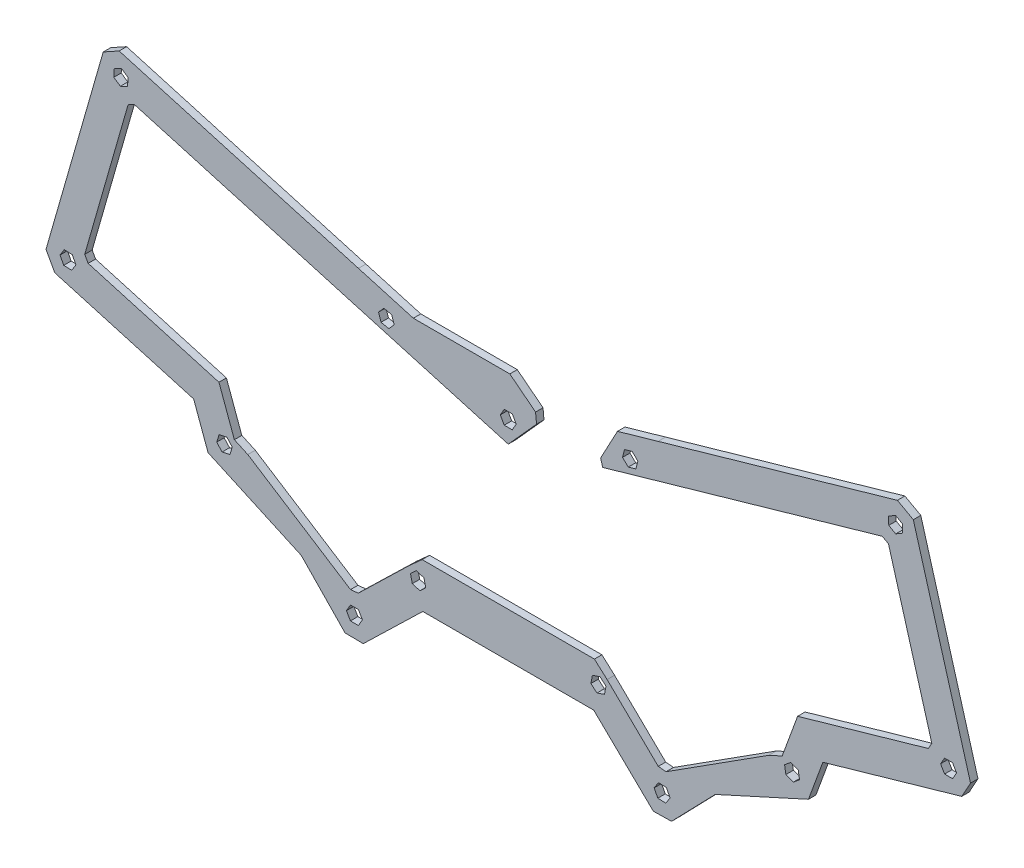
from build123d import *

# Parameters (mm, degrees)
BOSS_EXTRU_1_DEPTH = 3


with BuildPart() as part:
    # Esquisse1 → Boss.-Extru.1 (new body)
    with BuildSketch(Plane.XY):
        Polygon((-202.439042401, -93.715936913), (-207.540430482, -98.290842938), (-228.119574859, -118.248029963), (-231.240854108, -118.563827288), (-272.565847516, -92.169507978), (-277.959789872, -89.716454796), (-284.165989399, -72.783703169), (-336.775785376, -57.698086926), (-338.147034057, -55.224288823), (-320.713145188, 5.574907028), (-318.239316427, 6.946262636), (-167.795259872, -36.183821192), (-156.425730461, -23.544541546), (-156.815310501, -19.508703235), (-167.175777529, -11.401531345), (-205.982988252, -11.401531345), (-221.327812729, -7.001473731), (-228.053301524, -5.072970852), (-324.305573392, 22.521130566), (-330.707501003, 18.97225141), (-353.72243999, -61.290379239), (-350.173829458, -67.692242105), (-294.328030452, -83.705767284), (-288.532091821, -99.519179156), (-251.042661762, -116.568594893), (-233.45174982, -134.735979634), (-226.135810249, -134.851076098), (-202.175390102, -111.650948678), (-133.415129641, -111.650948678), (-109.454709494, -134.851076098), (-102.138769923, -134.735979634), (-84.547857981, -116.568594893), (-47.058427922, -99.519179156), (-41.262489291, -83.705767284), (14.583309715, -67.692242105), (18.131920247, -61.290379239), (-4.88301874, 18.97225141), (-11.284946351, 22.521130566), (-107.537218219, -5.072970852), (-114.262707014, -7.001473731), (-123.876268292, -9.758118068), (-130.649820486, -22.415487094), (-129.8232917, -25.297935522), (-127.904950096, -24.747859919), (-17.351203316, 6.946262636), (-14.877374555, 5.574907028), (2.556514314, -55.224288823), (1.185265633, -57.698086926), (-51.424530344, -72.783703169), (-57.630729871, -89.716454796), (-63.024672228, -92.169507978), (-104.349665635, -118.563827288), (-107.470944884, -118.248029963), (-128.050089261, -98.290842938), (-133.151477342, -93.715936913), align=None)
        Polygon((-226.456549288, -126.726039887), (-228.072581173, -129.499661036), (-231.282623491, -129.486946945), (-232.876633924, -126.700611704), (-231.260602039, -123.926990555), (-228.050559721, -123.939704646), align=None, mode=Mode.SUBTRACT)
        Polygon((-201.720052379, -99.68218544), (-200.986265397, -102.807259839), (-203.325765724, -105.005275206), (-206.399053033, -104.078216174), (-207.132840016, -100.953141775), (-204.793339689, -98.755126408), align=None, mode=Mode.SUBTRACT)
        Polygon((-278.801584282, -92.701419409), (-279.761510176, -95.764600045), (-282.89426537, -96.464870154), (-285.067094671, -94.101959627), (-284.107168778, -91.03877899), (-280.974413583, -90.338508881), align=None, mode=Mode.SUBTRACT)
        Polygon((-341.674936445, -60.693756917), (-343.381773974, -63.412440235), (-346.589641557, -63.293617233), (-348.09067161, -60.456110913), (-346.38383408, -57.737427596), (-343.175966498, -57.856250598), align=None, mode=Mode.SUBTRACT)
        Polygon((-102.716844109, -126.851692582), (-104.440215275, -129.559925429), (-107.647299303, -129.421558643), (-109.131012166, -126.574959009), (-107.407640999, -123.866726161), (-104.200556971, -124.005092948), align=None, mode=Mode.SUBTRACT)
        Polygon((-129.102521286, -103.979530359), (-132.134816884, -105.032961295), (-134.563262635, -102.933631743), (-133.959412787, -99.780871255), (-130.927117189, -98.727440319), (-128.498671438, -100.826769871), align=None, mode=Mode.SUBTRACT)
        Polygon((-51.178552765, -91.36063702), (-50.649763202, -94.526851626), (-53.127390703, -96.567904124), (-56.133807767, -95.442742016), (-56.662597331, -92.27652741), (-54.18496983, -90.235474912), align=None, mode=Mode.SUBTRACT)
        Polygon((10.897318032, -57.794933915), (12.502351781, -60.574933915), (10.897318032, -63.354933915), (7.687250536, -63.354933915), (6.082216787, -60.574933915), (7.687250536, -57.794933915), align=None, mode=Mode.SUBTRACT)
        Polygon((-217.840116073, -13.876277124), (-214.696831686, -14.527657653), (-213.689301579, -17.575512049), (-215.825055858, -19.971985915), (-218.968340246, -19.320605385), (-219.975870353, -16.272750989), align=None, mode=Mode.SUBTRACT)
        Polygon((-326.25776259, 15.467139628), (-323.377643582, 16.884689567), (-320.709949819, 15.09920831), (-320.922375064, 11.896177113), (-323.802494072, 10.478627174), (-326.470187835, 12.264108431), align=None, mode=Mode.SUBTRACT)
        Polygon((-169.385770719, -24.817214521), (-166.175746894, -24.833958909), (-164.585236046, -27.622293282), (-166.204749024, -30.393883267), (-169.414772849, -30.37713888), (-171.005283697, -27.588804506), align=None, mode=Mode.SUBTRACT)
        Polygon((-117.981174931, -13.809459943), (-115.672169645, -16.039488624), (-116.448928491, -19.154160201), (-119.534692623, -20.038803095), (-121.84369791, -17.808774414), (-121.066939064, -14.694102838), align=None, mode=Mode.SUBTRACT)
        Polygon((-12.039253575, 16.891491339), (-9.240055353, 15.320178943), (-9.201252694, 12.110345974), (-11.961648258, 10.471825402), (-14.76084648, 12.043137798), (-14.799649138, 15.252970767), align=None, mode=Mode.SUBTRACT)
    extrude(amount=BOSS_EXTRU_1_DEPTH)


solid = part.part
